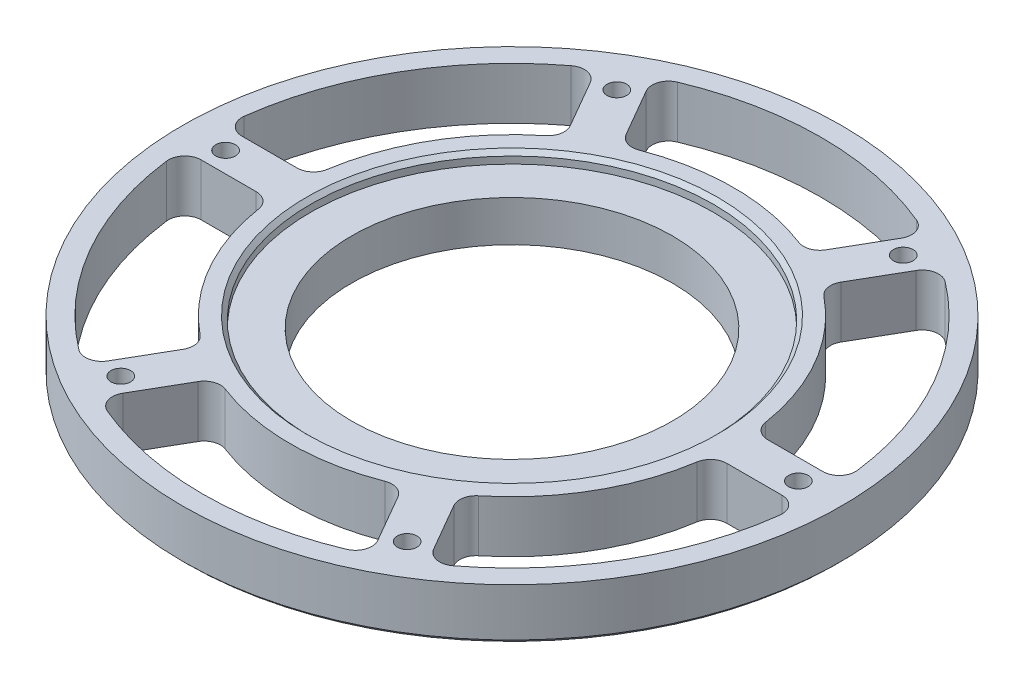
from build123d import *

# Parameters (mm, degrees)
F_12_0_189_DIAMETER_HOLE1_D = 4.8006
CIRPATTERN3_COUNT           = 6
CUT_EXTRUDE1_DEPTH          = 115.6206569515286
FILLET1_R                   = 4
CIRPATTERN4_COUNT           = 6
FILLET1_OF_CIRPATTERN4_R    = 4
CHAMFER1_SIZE               = 1
CHAMFER2_SIZE               = 1


with BuildPart() as part:
    # Sketch2 → Revolve1 (revolve)
    with BuildSketch(Plane(origin=(0, 0, 0), x_dir=(0, 0, -1), z_dir=(1, 0, 0))):
        Polygon((-39.2125, -8.7e-16), (-80.55, -5.06e-15), (-80.55, 12.699999999999994), (-49.2125, 12.699999999999994), (-49.21250000000001, 9.999999999999998), (-39.21250000000001, 9.999999999999998), align=None)
    revolve(axis=Axis((0, -0.6350000000000053, 0), (0, 1, 0)))

    # #12 (0.189) Diameter Hole1 (through all)
    with Locations(Plane(origin=(0, 12.699999999999994, 0), x_dir=(1, 0, 0), z_dir=(0, 1, 0))):
        with Locations((-35, 60.621778265)):
            f_12_0_189_diameter_hole1 = Hole(F_12_0_189_DIAMETER_HOLE1_D / 2)

    # CirPattern3: #12 (0.189) Diameter Hole1 ×6 about axis
    cirpattern3_axis = Axis((0, -0.6350000000000053, 0), (0, 1, 0))
    for i in range(1, CIRPATTERN3_COUNT):
        add(f_12_0_189_diameter_hole1.rotate(cirpattern3_axis, i * 360 / CIRPATTERN3_COUNT), mode=Mode.SUBTRACT)

    # Sketch8 → Cut-Extrude1 (cut, through all)
    with BuildSketch(Plane(origin=(0, 12.699999999999994, 0), x_dir=(1, 0, 0), z_dir=(0, 1, 0))):
        with BuildLine():
            Line((-33.36205552600358, 67.78477521597199), (-22.660589701137393, 49.249292691841845))
            ThreePointArc((-22.660589701137393, 49.249292691841845), (3.32e-15, 54.212500000000006), (22.660589701137393, 49.249292691841845))
            Line((22.660589701137393, 49.249292691841845), (33.36205552600358, 67.78477521597199))
            ThreePointArc((33.36205552600358, 67.78477521597199), (4.63e-15, 75.54999999999998), (-33.36205552600358, 67.78477521597199))
        make_face()
    cut_extrude1 = extrude(amount=-CUT_EXTRUDE1_DEPTH, mode=Mode.SUBTRACT)

    # Fillet1
    fillet1_edges = [part.edges().sort_by_distance(p)[0] for p in [
        (33.36205552600358, 6.349999999999996, -67.78477521597199),
        (22.660589701137397, 6.349999999999996, -49.249292691841845),
        (-33.36205552600357, 6.349999999999996, -67.78477521597199),
        (-22.660589701137393, 6.349999999999996, -49.249292691841845),
    ]]
    fillet(fillet1_edges, radius=FILLET1_R)

    # CirPattern4: Cut-Extrude1 ×6 about axis
    cirpattern4_axis = Axis((0, -0.6350000000000053, 0), (0, 1, 0))
    for i in range(1, CIRPATTERN4_COUNT):
        add(cut_extrude1.rotate(cirpattern4_axis, i * 360 / CIRPATTERN4_COUNT), mode=Mode.SUBTRACT)

    # Fillet1 of CirPattern4
    fillet1_of_cirpattern4_edges = [part.edges().sort_by_distance(p)[0] for p in [
        (-42.022309563847756, 6.349999999999996, -62.78477521597212),
        (-31.320843738981637, 6.349999999999996, -44.24929269184193),
        (-75.38436508985134, 6.349999999999996, -4.999999999999897),
        (-53.981433440119034, 6.349999999999996, -4.999999999999929),
        (-75.38436508985134, 6.349999999999996, 4.999999999999865),
        (-53.981433440119034, 6.349999999999996, 4.999999999999904),
        (-42.02230956384778, 6.349999999999996, 62.78477521597209),
        (-31.32084373898165, 6.349999999999996, 44.249292691841916),
        (-33.36205552600359, 6.349999999999996, 67.78477521597199),
        (-22.660589701137404, 6.349999999999996, 49.249292691841845),
        (33.362055526003566, 6.349999999999996, 67.78477521597199),
        (22.660589701137386, 6.349999999999996, 49.249292691841845),
        (42.02230956384773, 6.349999999999996, 62.78477521597213),
        (31.320843738981612, 6.349999999999996, 44.249292691841944),
        (75.38436508985134, 6.349999999999996, 4.999999999999925),
        (53.98143344011903, 6.349999999999996, 4.999999999999947),
        (75.38436508985134, 6.349999999999996, -4.99999999999989),
        (53.981433440119034, 6.349999999999996, -4.999999999999925),
        (42.022309563847756, 6.349999999999996, -62.784775215972104),
        (31.320843738981637, 6.349999999999996, -44.24929269184193),
    ]]
    fillet(fillet1_of_cirpattern4_edges, radius=FILLET1_OF_CIRPATTERN4_R)

    # Chamfer1
    chamfer1_edges = [part.edges().sort_by_distance(p)[0] for p in [
        (6.03e-15, 12.699999999999994, -49.2125),
    ]]
    chamfer(chamfer1_edges, length=CHAMFER1_SIZE)

    # Chamfer2
    chamfer2_edges = [part.edges().sort_by_distance(p)[0] for p in [
        (9.86e-15, -5.11e-15, -80.55),
    ]]
    chamfer(chamfer2_edges, length=CHAMFER2_SIZE)


solid = part.part
